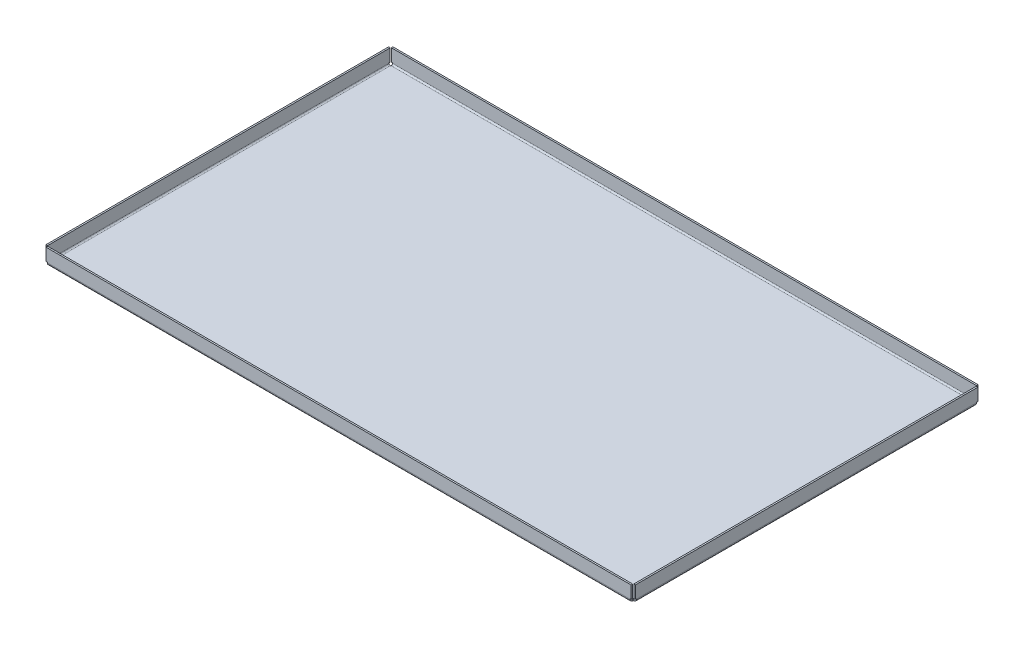
from build123d import *

# Parameters (mm, degrees)
SKETCH1_W                  = 760
SKETCH1_H                  = 454
BOSS_EXTRUDE1_DEPTH        = 20
SKETCH2_W                  = 740
SKETCH2_H                  = 434
CUT_EXTRUDE1_DEPTH         = 18
CONVERT_SOLID2_OUTLINE_W   = 15.7
CONVERT_SOLID2_OUTLINE_H   = 2
CONVERT_SOLID2_DEPTH       = 10.707106781
CONVERT_SOLID2_START       = 749.292893219
CONVERT_SOLID2_2_OUTLINE_W = 15.7
CONVERT_SOLID2_2_OUTLINE_H = 2
CONVERT_SOLID2_2_DEPTH     = 10.707106781
CONVERT_SOLID2_3_DEPTH     = 760
CONVERT_SOLID2_4_DEPTH     = 8
CONVERT_SOLID2_START_2     = 752
CONVERT_SOLID2_5_DEPTH     = 8
CONVERT_SOLID2_START_3     = 8
CONVERT_SOLID2_6_DEPTH     = 4.3
CONVERT_SOLID2_START_4     = 747.7
CONVERT_SOLID2_7_DEPTH     = 4.3
CONVERT_SOLID2_START_5     = 12.3
CONVERT_SOLID2_8_DEPTH     = 735.4
CONVERT_SOLID2_START_6     = -441.7
CONVERT_SOLID2_9_DEPTH     = 429.4
CONVERT_SOLID2_10_DEPTH    = 429.4


with BuildPart() as part:
    # Sketch1 → Boss-Extrude1 (new body)
    with BuildSketch(Plane(origin=(0, 0, 0), x_dir=(1, 0, 0), z_dir=(0, 1, 0))):
        with Locations((380, 227)):
            Rectangle(SKETCH1_W, SKETCH1_H)
    extrude(amount=BOSS_EXTRUDE1_DEPTH)

    # Sketch2 → Cut-Extrude1 (cut)
    with BuildSketch(Plane(origin=(0, 20, 0), x_dir=(1, 0, 0), z_dir=(0, 1, 0))):
        with Locations((380, 227)):
            Rectangle(SKETCH2_W, SKETCH2_H)
    extrude(amount=-CUT_EXTRUDE1_DEPTH, mode=Mode.SUBTRACT)

    # Convert-Solid2: read off the stored shape, not the designer's step
    # Convert-Solid2 outline → Convert-Solid2 (cut)
    with BuildSketch(Plane.YZ):
        with Locations((12.15, -9)):
            Rectangle(CONVERT_SOLID2_OUTLINE_W, CONVERT_SOLID2_OUTLINE_H)
        with Locations((12.15, -445)):
            Rectangle(CONVERT_SOLID2_OUTLINE_W, CONVERT_SOLID2_OUTLINE_H)
    extrude(amount=CONVERT_SOLID2_DEPTH, mode=Mode.SUBTRACT)

    # Convert-Solid2 2 outline → Convert-Solid2 2 (cut)
    with BuildSketch(Plane.YZ.offset(CONVERT_SOLID2_START)):
        with Locations((12.15, -9)):
            Rectangle(CONVERT_SOLID2_2_OUTLINE_W, CONVERT_SOLID2_2_OUTLINE_H)
        with Locations((12.15, -445)):
            Rectangle(CONVERT_SOLID2_2_OUTLINE_W, CONVERT_SOLID2_2_OUTLINE_H)
    extrude(amount=CONVERT_SOLID2_2_DEPTH, mode=Mode.SUBTRACT)

    # Convert-Solid2 3 outline → Convert-Solid2 3 (cut)
    with BuildSketch(Plane.YZ):
        with BuildLine():
            Line((4.3, -441.7), (2, -441.7))
            Line((2, -441.7), (2, -442.2))
            ThreePointArc((2, -442.2), (2.527207794, -443.472792206), (3.8, -444))
            Line((3.8, -444), (20, -444))
            Line((20, -444), (20, -443.292893219))
            Line((20, -443.292893219), (4.3, -443.292893219))
            Line((4.3, -443.292893219), (4.3, -441.7))
        make_face()
        with BuildLine():
            Line((2, -11.8), (2, -12.3))
            Line((2, -12.3), (4.3, -12.3))
            Line((4.3, -12.3), (4.3, -10.707106781))
            Line((4.3, -10.707106781), (20, -10.707106781))
            Line((20, -10.707106781), (20, -10))
            Line((20, -10), (3.8, -10))
            ThreePointArc((3.8, -10), (2.527207794, -10.527207794), (2, -11.8))
        make_face()
        with BuildLine():
            ThreePointArc((3.8, -446), (1.112994231, -444.887005769), (0, -442.2))
            Line((0, -442.2), (0, -454))
            Line((0, -454), (20, -454))
            Line((20, -454), (20, -446))
            Line((20, -446), (3.8, -446))
        make_face()
        with BuildLine():
            Line((0, 0), (0, -11.8))
            ThreePointArc((0, -11.8), (1.112994231, -9.112994231), (3.8, -8))
            Line((3.8, -8), (20, -8))
            Line((20, -8), (20, 0))
            Line((20, 0), (0, 0))
        make_face()
    extrude(amount=CONVERT_SOLID2_3_DEPTH, mode=Mode.SUBTRACT)

    # Convert-Solid2 4 outline → Convert-Solid2 4 (cut)
    with BuildSketch(Plane.YZ):
        with BuildLine():
            Line((2, -442.2), (2, -441.7))
            Line((2, -441.7), (4.3, -441.7))
            Line((4.3, -441.7), (4.3, -443.292893219))
            Line((4.3, -443.292893219), (20, -443.292893219))
            Line((20, -443.292893219), (20, -10.707106781))
            Line((20, -10.707106781), (4.3, -10.707106781))
            Line((4.3, -10.707106781), (4.3, -12.3))
            Line((4.3, -12.3), (2, -12.3))
            Line((2, -12.3), (2, -11.8))
            ThreePointArc((2, -11.8), (2.527207794, -10.527207794), (3.8, -10))
            Line((3.8, -10), (4.3, -10))
            Line((4.3, -10), (4.3, -8))
            Line((4.3, -8), (3.8, -8))
            ThreePointArc((3.8, -8), (1.112994231, -9.112994231), (0, -11.8))
            Line((0, -11.8), (0, -442.2))
            ThreePointArc((0, -442.2), (1.112994231, -444.887005769), (3.8, -446))
            Line((3.8, -446), (4.3, -446))
            Line((4.3, -446), (4.3, -444))
            Line((4.3, -444), (3.8, -444))
            ThreePointArc((3.8, -444), (2.527207794, -443.472792206), (2, -442.2))
        make_face()
    extrude(amount=CONVERT_SOLID2_4_DEPTH, mode=Mode.SUBTRACT)

    # Convert-Solid2 5 outline → Convert-Solid2 5 (cut)
    with BuildSketch(Plane.YZ.offset(CONVERT_SOLID2_START_2)):
        with BuildLine():
            Line((2, -442.2), (2, -441.7))
            Line((2, -441.7), (4.3, -441.7))
            Line((4.3, -441.7), (4.3, -443.292893219))
            Line((4.3, -443.292893219), (20, -443.292893219))
            Line((20, -443.292893219), (20, -10.707106781))
            Line((20, -10.707106781), (4.3, -10.707106781))
            Line((4.3, -10.707106781), (4.3, -12.3))
            Line((4.3, -12.3), (2, -12.3))
            Line((2, -12.3), (2, -11.8))
            ThreePointArc((2, -11.8), (2.527207794, -10.527207794), (3.8, -10))
            Line((3.8, -10), (4.3, -10))
            Line((4.3, -10), (4.3, -8))
            Line((4.3, -8), (3.8, -8))
            ThreePointArc((3.8, -8), (1.112994231, -9.112994231), (0, -11.8))
            Line((0, -11.8), (0, -442.2))
            ThreePointArc((0, -442.2), (1.112994231, -444.887005769), (3.8, -446))
            Line((3.8, -446), (4.3, -446))
            Line((4.3, -446), (4.3, -444))
            Line((4.3, -444), (3.8, -444))
            ThreePointArc((3.8, -444), (2.527207794, -443.472792206), (2, -442.2))
        make_face()
    extrude(amount=CONVERT_SOLID2_5_DEPTH, mode=Mode.SUBTRACT)

    # Convert-Solid2 6 outline → Convert-Solid2 6 (cut)
    with BuildSketch(Plane.YZ.offset(CONVERT_SOLID2_START_3)):
        with BuildLine():
            Line((2, -442.2), (2, -441.7))
            Line((2, -441.7), (0, -441.7))
            Line((0, -441.7), (0, -442.2))
            ThreePointArc((0, -442.2), (1.112994231, -444.887005769), (3.8, -446))
            Line((3.8, -446), (4.3, -446))
            Line((4.3, -446), (4.3, -444))
            Line((4.3, -444), (3.8, -444))
            ThreePointArc((3.8, -444), (2.527207794, -443.472792206), (2, -442.2))
        make_face()
        with BuildLine():
            Line((0, -12.3), (2, -12.3))
            Line((2, -12.3), (2, -11.8))
            ThreePointArc((2, -11.8), (2.527207794, -10.527207794), (3.8, -10))
            Line((3.8, -10), (4.3, -10))
            Line((4.3, -10), (4.3, -8))
            Line((4.3, -8), (3.8, -8))
            ThreePointArc((3.8, -8), (1.112994231, -9.112994231), (0, -11.8))
            Line((0, -11.8), (0, -12.3))
        make_face()
    extrude(amount=CONVERT_SOLID2_6_DEPTH, mode=Mode.SUBTRACT)

    # Convert-Solid2 7 outline → Convert-Solid2 7 (cut)
    with BuildSketch(Plane.YZ.offset(CONVERT_SOLID2_START_4)):
        with BuildLine():
            Line((2, -442.2), (2, -441.7))
            Line((2, -441.7), (0, -441.7))
            Line((0, -441.7), (0, -442.2))
            ThreePointArc((0, -442.2), (1.112994231, -444.887005769), (3.8, -446))
            Line((3.8, -446), (4.3, -446))
            Line((4.3, -446), (4.3, -444))
            Line((4.3, -444), (3.8, -444))
            ThreePointArc((3.8, -444), (2.527207794, -443.472792206), (2, -442.2))
        make_face()
        with BuildLine():
            Line((0, -12.3), (2, -12.3))
            Line((2, -12.3), (2, -11.8))
            ThreePointArc((2, -11.8), (2.527207794, -10.527207794), (3.8, -10))
            Line((3.8, -10), (4.3, -10))
            Line((4.3, -10), (4.3, -8))
            Line((4.3, -8), (3.8, -8))
            ThreePointArc((3.8, -8), (1.112994231, -9.112994231), (0, -11.8))
            Line((0, -11.8), (0, -12.3))
        make_face()
    extrude(amount=CONVERT_SOLID2_7_DEPTH, mode=Mode.SUBTRACT)

    # Convert-Solid2 8 outline → Convert-Solid2 8 (add)
    with BuildSketch(Plane.YZ.offset(CONVERT_SOLID2_START_5)):
        with BuildLine():
            ThreePointArc((3.8, -444), (2.527207794, -443.472792206), (2, -442.2))
            Line((2, -442.2), (2, -444))
            Line((2, -444), (3.8, -444))
        make_face()
        with BuildLine():
            Line((2, -10), (2, -11.8))
            ThreePointArc((2, -11.8), (2.527207794, -10.527207794), (3.8, -10))
            Line((3.8, -10), (2, -10))
        make_face()
    extrude(amount=CONVERT_SOLID2_8_DEPTH)

    # Convert-Solid2 9 outline → Convert-Solid2 9 (cut)
    with BuildSketch(Plane.XY.offset(CONVERT_SOLID2_START_6)):
        with BuildLine():
            Line((752, 0), (752, 3.8))
            ThreePointArc((752, 3.8), (750.887005769, 1.112994231), (748.2, 0))
            Line((748.2, 0), (752, 0))
        make_face()
        with BuildLine():
            Line((8, 0), (11.8, 0))
            ThreePointArc((11.8, 0), (9.112994231, 1.112994231), (8, 3.8))
            Line((8, 3.8), (8, 0))
        make_face()
    extrude(amount=CONVERT_SOLID2_9_DEPTH, mode=Mode.SUBTRACT)

    # Convert-Solid2 10 outline → Convert-Solid2 10 (add)
    with BuildSketch(Plane.XY.offset(CONVERT_SOLID2_START_6)):
        with BuildLine():
            Line((750, 2), (750, 3.8))
            ThreePointArc((750, 3.8), (749.472792206, 2.527207794), (748.2, 2))
            Line((748.2, 2), (750, 2))
        make_face()
        with BuildLine():
            Line((10, 2), (11.8, 2))
            ThreePointArc((11.8, 2), (10.527207794, 2.527207794), (10, 3.8))
            Line((10, 3.8), (10, 2))
        make_face()
    extrude(amount=CONVERT_SOLID2_10_DEPTH)


solid = part.part
